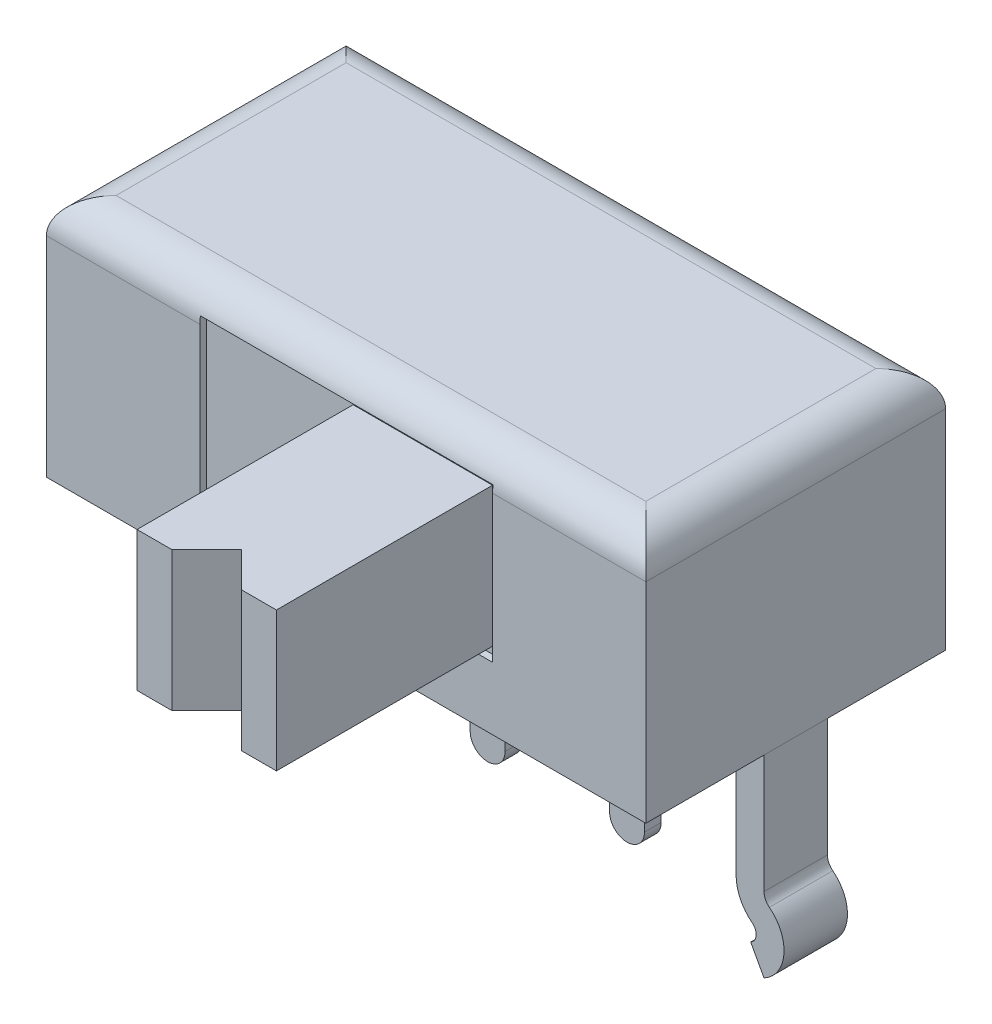
from build123d import *

# Parameters (mm, degrees)
SKETCH1_W             = 8.6
SKETCH1_H             = 4.3
BOSS_EXTRUDE1_DEPTH   = 3.5
BOSS_EXTRUDE2_DEPTH   = 0.455
BOSS_EXTRUDE2_2_DEPTH = 0.455
BOSS_EXTRUDE3_DEPTH   = 0.12
BOSS_EXTRUDE3_2_DEPTH = 0.12
BOSS_EXTRUDE3_3_DEPTH = 0.12
CUT_EXTRUDE1_DEPTH    = 0.1
BOSS_EXTRUDE4_DEPTH   = 3.1
CUT_EXTRUDE2_DEPTH    = 9.992249788
FILLET1_R             = 0.5


with BuildPart() as part:
    # Sketch1 → Boss-Extrude1 (new body)
    with BuildSketch(Plane(origin=(0, 0, 0), x_dir=(1, 0, 0), z_dir=(0, 1, 0))):
        Rectangle(SKETCH1_W, SKETCH1_H)
    extrude(amount=BOSS_EXTRUDE1_DEPTH)

    # Sketch4 → Cut-Extrude1 (cut)
    with BuildSketch(Plane.XY.offset(2.15)):
        Polygon((2.1, 0.9), (2.1, 3.1), (1.5, 3.1), (1, 3.1), (0.5, 3.1), (-0.5, 3.1), (-1, 3.1), (-1.5, 3.1), (-2.1, 3.1), (-2.1, 0.9), (-1.5, 0.9), (-1, 0.9), (-0.5, 0.9), (0.5, 0.9), (1, 0.9), (1.5, 0.9), align=None)
    extrude(amount=-CUT_EXTRUDE1_DEPTH, mode=Mode.SUBTRACT)

    # Fillet1
    # the kernel refuses this fillet: 0.5 mm, written as the material it takes off along each edge
    with BuildSketch(Plane(origin=(-4.3, 3.5, 3.4), x_dir=(1, 0, 0), z_dir=(0, 0, -1))) as fillet1_piece_1:
        with BuildLine():
            CenterArc((FILLET1_R, FILLET1_R), FILLET1_R, 180, 90)
            Line((0, FILLET1_R), (0, 0))
            Line((0, 0), (FILLET1_R, 0))
        make_face()
    extrude(amount=6.8, mode=Mode.SUBTRACT)
    with BuildSketch(Plane(origin=(-5.55, 3.5, -2.15), x_dir=(0, 0, 1), z_dir=(1, 0, 0))) as fillet1_piece_2:
        with BuildLine():
            CenterArc((FILLET1_R, FILLET1_R), FILLET1_R, 180, 90)
            Line((0, FILLET1_R), (0, 0))
            Line((0, 0), (FILLET1_R, 0))
        make_face()
    extrude(amount=11.1, mode=Mode.SUBTRACT)
    with BuildSketch(Plane(origin=(4.3, 3.5, -3.4), x_dir=(0, -1, 0), z_dir=(0, 0, 1))) as fillet1_piece_3:
        with BuildLine():
            CenterArc((FILLET1_R, -FILLET1_R), FILLET1_R, 90, 90)
            Line((0, -FILLET1_R), (0, 0))
            Line((0, 0), (FILLET1_R, 0))
        make_face()
    extrude(amount=6.8, mode=Mode.SUBTRACT)
    with BuildSketch(Plane(origin=(5.55, 3.5, 2.15), x_dir=(0, -1, 0), z_dir=(-1, 0, 0))) as fillet1_piece_4:
        with BuildLine():
            CenterArc((FILLET1_R, -FILLET1_R), FILLET1_R, 90, 90)
            Line((0, -FILLET1_R), (0, 0))
            Line((0, 0), (FILLET1_R, 0))
        make_face()
    extrude(amount=11.1, mode=Mode.SUBTRACT)


with BuildPart() as body_2:
    # Sketch2 → Boss-Extrude2 (new, symmetric)
    with BuildSketch(Plane.XY):
        with BuildLine():
            Line((3.9, 0), (3.9, -1.696266343))
            ThreePointArc((3.9, -1.696266343), (3.960555842, -1.958944854), (4.13, -2.16860097))
            ThreePointArc((4.13, -2.16860097), (4.18697768, -2.299191552), (4.109090909, -2.41849791))
            Line((4.109090909, -2.41849791), (4.3, -2.77))
            ThreePointArc((4.3, -2.77), (4.585584827, -2.332543353), (4.376666667, -1.853711219))
            ThreePointArc((4.376666667, -1.853711219), (4.320185281, -1.783825846), (4.3, -1.696266343))
            Line((4.3, -1.696266343), (4.3, 0))
            Line((4.3, 0), (3.9, 0))
        make_face()
    extrude(amount=BOSS_EXTRUDE2_DEPTH, both=True)


with BuildPart() as body_3:
    # Sketch2 → Boss-Extrude2 2 (new, symmetric)
    with BuildSketch(Plane.XY):
        with BuildLine():
            Line((-4.3, -2.77), (-4.109090909, -2.41849791))
            ThreePointArc((-4.109090909, -2.41849791), (-4.18697768, -2.299191552), (-4.13, -2.16860097))
            ThreePointArc((-4.13, -2.16860097), (-3.960555842, -1.958944854), (-3.9, -1.696266343))
            Line((-3.9, -1.696266343), (-3.9, 0))
            Line((-3.9, 0), (-4.3, 0))
            Line((-4.3, 0), (-4.3, -1.696266343))
            ThreePointArc((-4.3, -1.696266343), (-4.320185281, -1.783825846), (-4.376666667, -1.853711219))
            ThreePointArc((-4.376666667, -1.853711219), (-4.585584827, -2.332543353), (-4.3, -2.77))
        make_face()
    extrude(amount=BOSS_EXTRUDE2_2_DEPTH, both=True)


with BuildPart() as body_4:
    # Sketch3 → Boss-Extrude3 (new, symmetric)
    with BuildSketch(Plane.XY):
        with BuildLine():
            Line((2.25, -2.15), (2.25, 0))
            Line((2.25, 0), (1.75, 0))
            Line((1.75, 0), (1.75, -2.15))
            ThreePointArc((1.75, -2.15), (2, -2.4), (2.25, -2.15))
        make_face()
    extrude(amount=BOSS_EXTRUDE3_DEPTH, both=True)


with BuildPart() as body_5:
    # Sketch3 → Boss-Extrude3 2 (new, symmetric)
    with BuildSketch(Plane.XY):
        with BuildLine():
            Line((0.25, -2.15), (0.25, 0))
            Line((0.25, 0), (-0.25, 0))
            Line((-0.25, 0), (-0.25, -2.15))
            ThreePointArc((-0.25, -2.15), (0, -2.4), (0.25, -2.15))
        make_face()
    extrude(amount=BOSS_EXTRUDE3_2_DEPTH, both=True)


with BuildPart() as body_6:
    # Sketch3 → Boss-Extrude3 3 (new, symmetric)
    with BuildSketch(Plane.XY):
        with BuildLine():
            Line((-1.75, -2.15), (-1.75, 0))
            Line((-1.75, 0), (-2.25, 0))
            Line((-2.25, 0), (-2.25, -2.15))
            ThreePointArc((-2.25, -2.15), (-2, -2.4), (-1.75, -2.15))
        make_face()
    extrude(amount=BOSS_EXTRUDE3_3_DEPTH, both=True)


with BuildPart() as body_7:
    # Sketch5 → Boss-Extrude4 (new body)
    with BuildSketch(Plane.XY.offset(2.05)):
        Polygon((0.5, 3), (0, 3), (0, 1), (0.5, 1), (1, 1), (1.5, 1), (2, 1), (2, 3), (1.5, 3), (1, 3), align=None)
    extrude(amount=BOSS_EXTRUDE4_DEPTH)

    # Sketch6 → Cut-Extrude2 (cut, through all)
    with BuildSketch(Plane(origin=(0, 3, 0), x_dir=(1, 0, 0), z_dir=(0, 1, 0))):
        Polygon((0.5, -5.15), (1.5, -5.15), (1, -4.65), align=None)
    extrude(amount=-CUT_EXTRUDE2_DEPTH, mode=Mode.SUBTRACT)


solid = Compound([part.part, body_2.part, body_3.part, body_4.part, body_5.part, body_6.part, body_7.part])
